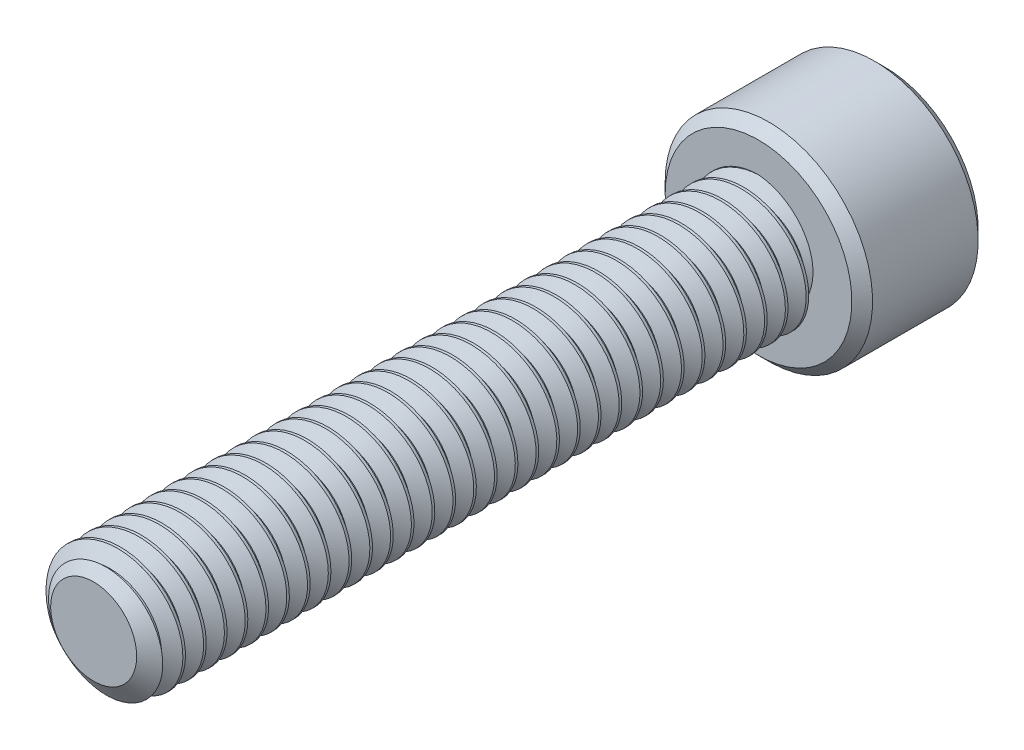
from build123d import *

# Parameters (mm, degrees)
SKETCH1_R          = 2.413
EXTRUDE1_DEPTH     = 25.4
CUT_SWEEP1_PITCH   = 0.79375
SKETCH6_R          = 3.9624
EXTRUDE2_DEPTH     = 4.826
CUT_EXTRUDE1_DEPTH = 2.9765625
CHAMFER1_SIZE      = 0.39624


with BuildPart() as part:
    # Sketch1 → Extrude1 (new body)
    with BuildSketch(Plane.XY):
        Circle(SKETCH1_R)
    extrude(amount=-EXTRUDE1_DEPTH)

    # Cut-Sweep1: arcs per turn and ends read off the stored shape
    # Cut-Sweep1: the profile of Sketch3 profile screwed along a right-hand helix through 35 turns, 6 arcs to a turn; built about Z, then put on its axis
    cut_sweep1_z = Axis((0, 0, 0), (0, 0, 1))
    cut_sweep1_corners = [(2.4133, 0, -1.488454455), (1.897444252, 0, -1.190625), (1.897444252, 0, -1.09140625), (2.4133, 0, -0.793576795)]
    with BuildLine(mode=Mode.PRIVATE) as cut_sweep1_profile:
        Line(cut_sweep1_corners[0], cut_sweep1_corners[1])
        Line(cut_sweep1_corners[1], cut_sweep1_corners[2])
        Line(cut_sweep1_corners[2], cut_sweep1_corners[3])
        Line(cut_sweep1_corners[3], cut_sweep1_corners[0])
    cut_sweep1_cap = Face(cut_sweep1_profile.wire())
    cut_sweep1_turn_angles = [0, 30, 60, 90, 120, 150, 180, 210, 240, 270, 300, 330, 360]
    cut_sweep1_turn_weights = [1, 0.8660254037844387, 1, 0.8660254037844387, 1, 0.8660254037844387, 1, 0.8660254037844387, 1, 0.8660254037844387, 1, 0.8660254037844387, 1]
    cut_sweep1_turn_rails = [Edge.make_bspline([Vector(p[0], p[1], 0).rotate(cut_sweep1_z, cut_sweep1_turn_angles[k]) / cut_sweep1_turn_weights[k] + Vector(0, 0, p[2] + CUT_SWEEP1_PITCH * cut_sweep1_turn_angles[k] / 360) for k in range(13)], [0, 0, 0, 1, 1, 2, 2, 3, 3, 4, 4, 5, 5, 6, 6, 6], 2, cut_sweep1_turn_weights) for p in cut_sweep1_corners]
    cut_sweep1_turn_sides = [Face.make_surface_from_curves(cut_sweep1_turn_rails[p[0]], cut_sweep1_turn_rails[p[1]]) for p in [(0, 1), (1, 2), (2, 3), (3, 0)]]
    cut_sweep1 = Plane(origin=(0, 0, 0), x_dir=(0, 1, 0), z_dir=(0, 0, -1)) * Solid(Shell([*[p.moved(Location((0, 0, CUT_SWEEP1_PITCH * i))) for i in range(35) for p in cut_sweep1_turn_sides], cut_sweep1_cap, cut_sweep1_cap.rotate(cut_sweep1_z, 12600).moved(Location((0, 0, CUT_SWEEP1_PITCH * 12600 / 360)))]))
    add(cut_sweep1, mode=Mode.SUBTRACT)

    # Sketch4 → Cut-Revolve1 (revolve, cut)
    with BuildSketch(Plane(origin=(0, 0, 0), x_dir=(0, 0, -1), z_dir=(1, 0, 0)), mode=Mode.PRIVATE) as cut_revolve1_sk:
        Polygon((0.538848736, 2.413), (0, 1.643444252), (0, 2.413), align=None)
    revolve(cut_revolve1_sk.sketch.rotate(Axis((0, 0, 0), (0, 0, -1)), 261.048315518), axis=Axis((0, 0, 0), (0, 0, -1)), mode=Mode.SUBTRACT)

    # Sketch6 → Extrude2 (add)
    with BuildSketch(Plane(origin=(0, 0, -25.4), x_dir=(-1, 0, 0), z_dir=(0, 0, -1))):
        Circle(SKETCH6_R)
    extrude(amount=EXTRUDE2_DEPTH)

    # Sketch7 → Cut-Extrude1 (cut)
    with BuildSketch(Plane(origin=(0, 0, -30.226), x_dir=(-1, 0, 0), z_dir=(0, 0, -1))):
        Polygon((0, 2.291358881), (-1.984375, 1.14567944), (-1.984375, -1.14567944), (0, -2.291358881), (1.984375, -1.14567944), (1.984375, 1.14567944), align=None)
    extrude(amount=-CUT_EXTRUDE1_DEPTH, mode=Mode.SUBTRACT)

    # Cut-Extrude2 cone 1 section (through the dimple's axis) → Cut-Extrude2 (revolve, cut)
    with BuildSketch(Plane(origin=(0, 0, -30.226), x_dir=(0, 1, 0), z_dir=(1, 0, 0))):
        Polygon((0, 0), (2.291358881, 0), (0, 2.291358881), align=None)
    revolve(axis=Axis((0, 0, -30.226), (0, 0, 1)), mode=Mode.SUBTRACT)

    # Chamfer1
    chamfer1_edges = [part.edges().sort_by_distance(p)[0] for p in [
        (3.9624, 0, -25.4),
        (3.9624, 0, -30.226),
    ]]
    chamfer(chamfer1_edges, length=CHAMFER1_SIZE)


solid = part.part
